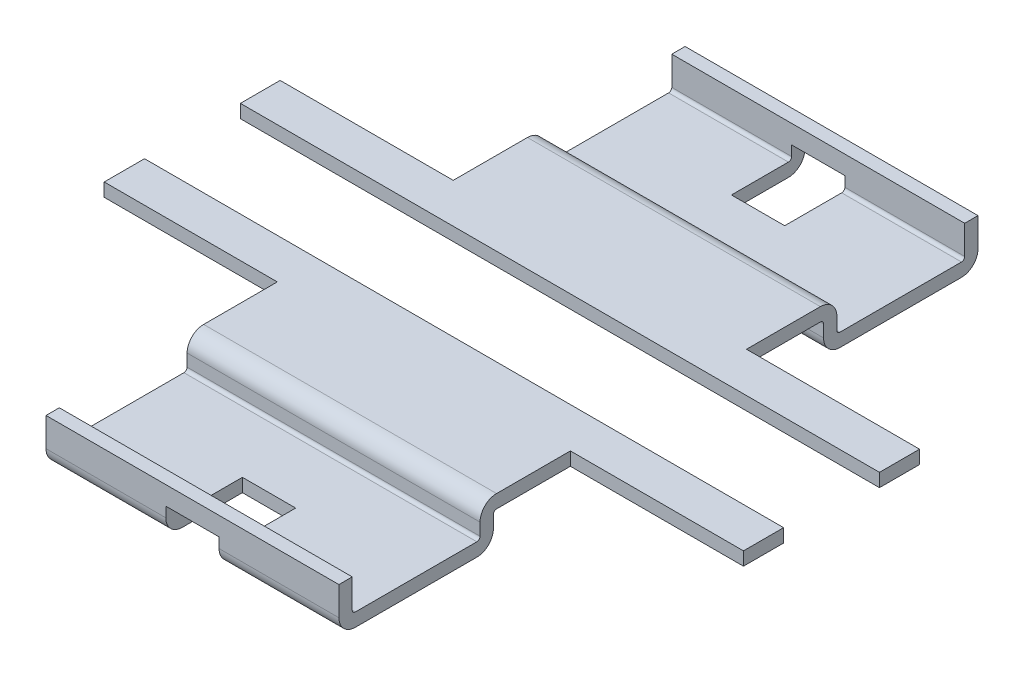
from build123d import *

# Parameters (mm, degrees)
BASE_FLANGE1_DEPTH      = 6
BASE_FLANGE1_DEPTH_BACK = 6
SKETCH6_W               = 13.296859842
SKETCH6_H               = 1.8
CUT_EXTRUDE1_DEPTH      = 9.527748824
SKETCH13_W              = 4.845267679
SKETCH13_H              = 2.171613948
CUT_EXTRUDE2_DEPTH      = 3.25
SKETCH14_W              = 4.988611219
SKETCH14_H              = 2.401394512
CUT_EXTRUDE3_DEPTH      = 3.25
SKETCH15_W              = 4.899845387
SKETCH15_H              = 2.254166158
CUT_EXTRUDE4_DEPTH      = 3.25
SKETCH16_W              = 4.867112092
SKETCH16_H              = 2.480011595
CUT_EXTRUDE5_DEPTH      = 3.25
SKETCH20_W              = 1
SKETCH20_H              = 1.552815678
CUT_EXTRUDE8_DEPTH      = 0.5
SKETCH21_W              = 1
SKETCH21_H              = 1.847683093
CUT_EXTRUDE9_DEPTH      = 0.5


# Sheet-metal steps are written as plain solids
with BuildPart() as part:
    # Sketch1 → Base-Flange1 (new, two sides: drawn at the far end of the back side and taken through both)
    with BuildSketch(Plane(origin=(0, 0, 0), x_dir=(0, 0, -1), z_dir=(1, 0, 0)).offset(-BASE_FLANGE1_DEPTH_BACK)):
        with BuildLine():
            Line((-5.75, 0), (-5.75, -0.54))
            ThreePointArc((-5.75, -0.54), (-5.732426407, -0.582426407), (-5.69, -0.6))
            Line((-5.69, -0.6), (-3.41, -0.6))
            ThreePointArc((-3.41, -0.6), (-3.367573593, -0.582426407), (-3.35, -0.54))
            Line((-3.35, -0.54), (-3.35, -0.31))
            ThreePointArc((-3.35, -0.31), (-3.259203102, -0.090796898), (-3.04, 0))
            Line((-3.04, 0), (3.04, 0))
            ThreePointArc((3.04, 0), (3.259203102, -0.090796898), (3.35, -0.31))
            Line((3.35, -0.31), (3.35, -0.54))
            ThreePointArc((3.35, -0.54), (3.367573593, -0.582426407), (3.41, -0.6))
            Line((3.41, -0.6), (5.69, -0.6))
            ThreePointArc((5.69, -0.6), (5.732426407, -0.582426407), (5.75, -0.54))
            Line((5.75, -0.54), (5.75, 0))
            Line((5.75, 0), (6, 0))
            Line((6, 0), (6, -0.54))
            ThreePointArc((6, -0.54), (5.909203102, -0.759203102), (5.69, -0.85))
            Line((5.69, -0.85), (3.41, -0.85))
            ThreePointArc((3.41, -0.85), (3.190796898, -0.759203102), (3.1, -0.54))
            Line((3.1, -0.54), (3.1, -0.31))
            ThreePointArc((3.1, -0.31), (3.082426407, -0.267573593), (3.04, -0.25))
            Line((3.04, -0.25), (-3.04, -0.25))
            ThreePointArc((-3.04, -0.25), (-3.082426407, -0.267573593), (-3.1, -0.31))
            Line((-3.1, -0.31), (-3.1, -0.54))
            ThreePointArc((-3.1, -0.54), (-3.190796898, -0.759203102), (-3.41, -0.85))
            Line((-3.41, -0.85), (-5.69, -0.85))
            ThreePointArc((-5.69, -0.85), (-5.909203102, -0.759203102), (-6, -0.54))
            Line((-6, -0.54), (-6, 0))
            Line((-6, 0), (-5.75, 0))
        make_face()
    extrude(amount=BASE_FLANGE1_DEPTH + BASE_FLANGE1_DEPTH_BACK)

    # Sketch6 → Cut-Extrude1 (cut, through all)
    with BuildSketch(Plane(origin=(0, 0, 0), x_dir=(1, 0, 0), z_dir=(0, 1, 0))):
        Rectangle(SKETCH6_W, SKETCH6_H)
    extrude(amount=-CUT_EXTRUDE1_DEPTH, mode=Mode.SUBTRACT)


with BuildPart() as cut_extrude1_piece_1:
    # of the separate pieces the step leaves, piece 1, a body of its own (cut_extrude1_pieces)
    add(part.part.solids().sort_by_distance((6, -0.85, 5.69))[0])

    # Sketch14 → Cut-Extrude3 (cut)
    with BuildSketch(Plane.ZY.offset(6)):
        with Locations((4.151248365, -0.072869224)):
            Rectangle(SKETCH14_W, SKETCH14_H)
    extrude(amount=-CUT_EXTRUDE3_DEPTH, mode=Mode.SUBTRACT)

    # Sketch15 → Cut-Extrude4 (cut)
    with BuildSketch(Plane(origin=(6, 0, 0), x_dir=(0, 0, -1), z_dir=(1, 0, 0))):
        with Locations((-4.103738605, -0.027890916)):
            Rectangle(SKETCH15_W, SKETCH15_H)
    extrude(amount=-CUT_EXTRUDE4_DEPTH, mode=Mode.SUBTRACT)

    # Sketch21 → Cut-Extrude9 (cut)
    with BuildSketch(Plane.XZ.offset(0.85)):
        with Locations((0, 5.485895168)):
            Rectangle(SKETCH21_W, SKETCH21_H)
    extrude(amount=-CUT_EXTRUDE9_DEPTH, mode=Mode.SUBTRACT)


with BuildPart() as cut_extrude1_piece_2:
    # of the separate pieces the step leaves, piece 2, a body of its own (cut_extrude1_pieces)
    add(part.part.solids().sort_by_distance((6, -0.25, -3.04))[0])

    # Sketch13 → Cut-Extrude2 (cut)
    with BuildSketch(Plane.ZY.offset(6)):
        with Locations((-4.068980064, -0.124769523)):
            Rectangle(SKETCH13_W, SKETCH13_H)
    extrude(amount=-CUT_EXTRUDE2_DEPTH, mode=Mode.SUBTRACT)

    # Sketch16 → Cut-Extrude5 (cut)
    with BuildSketch(Plane(origin=(6, 0, 0), x_dir=(0, 0, -1), z_dir=(1, 0, 0))):
        with Locations((4.086402332, -0.000253921)):
            Rectangle(SKETCH16_W, SKETCH16_H)
    extrude(amount=-CUT_EXTRUDE5_DEPTH, mode=Mode.SUBTRACT)

    # Sketch20 → Cut-Extrude8 (cut)
    with BuildSketch(Plane.XZ.offset(0.85)):
        with Locations((0, -5.396434848)):
            Rectangle(SKETCH20_W, SKETCH20_H)
    extrude(amount=-CUT_EXTRUDE8_DEPTH, mode=Mode.SUBTRACT)


solid = Compound([cut_extrude1_piece_1.part, cut_extrude1_piece_2.part])
